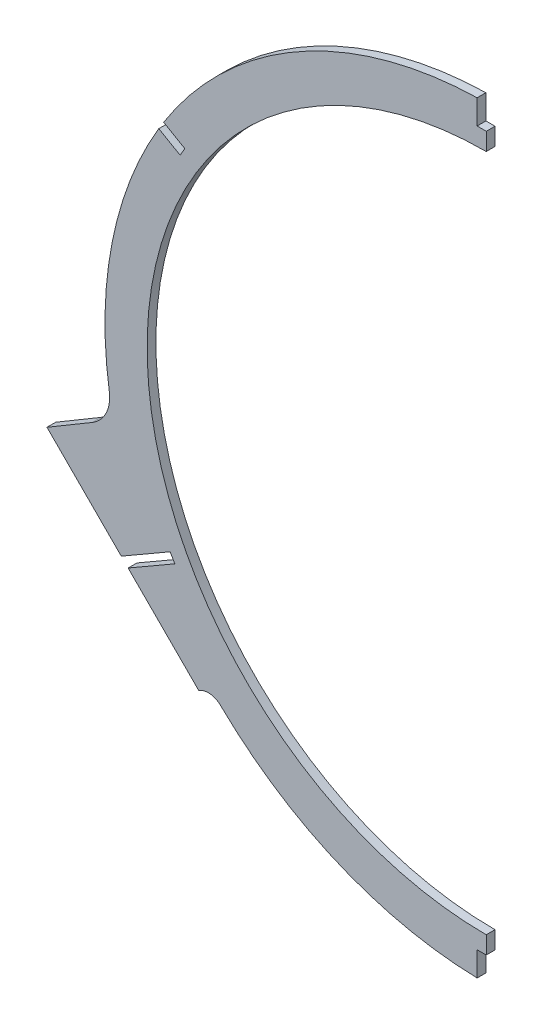
from build123d import *

# Parameters (mm, degrees)
SKETCH2_R           = 137.922
SKETCH2_R_2         = 122.682
BOSS_EXTRUDE2_DEPTH = 1.5875
SKETCH3_W           = 290.977734258
SKETCH3_H           = 504.828840158
CUT_EXTRUDE1_DEPTH  = 205.235122161
BOSS_EXTRUDE3_DEPTH = 1.5875
FILLET2_R           = 6.35
FILLET3_R           = 12.7
SKETCH5_W           = 3.302
SKETCH5_H           = 10.16
SKETCH5_H_2         = 10.320651629
CUT_EXTRUDE2_DEPTH  = 219.975089365


with BuildPart() as part:
    # Sketch2 → Boss-Extrude2 (new, symmetric)
    with BuildSketch(Plane(origin=(248.273568551, -245.01347209, 0), x_dir=(0, -1, 0), z_dir=(0, 0, -1))):
        with Locations(Location((-257.71347209, 248.273568551, 0), (0, 0, 180))):
            Circle(SKETCH2_R)
        with Locations(Location((-257.71347209, 248.273568551, 0), (0, 0, 180))):
            Circle(SKETCH2_R_2, mode=Mode.SUBTRACT)
    extrude(amount=BOSS_EXTRUDE2_DEPTH, both=True)

    # Sketch3 → Cut-Extrude1 (cut, through all)
    with BuildSketch(Plane(origin=(0, 0, 0), x_dir=(0, 0, -1), z_dir=(1, 0, 0))):
        with Locations((4.206907001, 10.947122083)):
            Rectangle(SKETCH3_W, SKETCH3_H)
    extrude(amount=CUT_EXTRUDE1_DEPTH, mode=Mode.SUBTRACT)

    # Sketch4 → Boss-Extrude3 (add, symmetric)
    with BuildSketch(Plane.XY):
        with BuildLine():
            Line((-158.91199531, -30.452559211), (-104.007060596, -85.469026207))
            ThreePointArc((-104.007060596, -85.469026207), (-101.940396796, -83.943553525), (-99.869204781, -82.424234664))
            ThreePointArc((-99.869204781, -82.424234664), (-121.945025923, -51.735150773), (-134.859098706, -16.205044198))
            Line((-134.859098706, -16.205044198), (-158.91199531, -30.452559211))
        make_face()
    extrude(amount=BOSS_EXTRUDE3_DEPTH, both=True)

    # Fillet2
    # the kernel refuses this fillet: 6.35 mm, written as the material it adds along each edge
    with BuildSketch(Plane(origin=(-99.869204781, -82.424234664, 1.5875), x_dir=(0.7036137196097393, -0.7105826718805821, 0), z_dir=(0, 0, -1))) as fillet2_piece_1:
        with BuildLine():
            CenterArc((5.474610705, 6.348804924), FILLET2_R, 191.50159108, 77.386791497)
            Line((-0.747876011, 5.082645744), (-0.872325745, 5.057322561))
            ThreePointArc((-0.872325745, 5.057322561), (-0.503364548, 2.522278655), (-0.12559154, -0.018861738))
            Line((-0.12559154, -0.018861738), (0.002463821, -0.126976098))
            ThreePointArc((0.002463821, -0.126976098), (2.675709823, -0.101042949), (5.348955824, -0.126976098))
            Line((5.348955824, -0.126976098), (5.351419645, 0))
        make_face()
    extrude(amount=3.175)

    # Fillet3
    fillet3_edges = [part.edges().sort_by_distance(p)[0] for p in [
        (-134.859098706, -16.205044198, 0),
    ]]
    fillet(fillet3_edges, radius=FILLET3_R)

    # Sketch5 → Cut-Extrude2 (cut, through all)
    with BuildSketch(Plane(origin=(0, 0, -1.5875), x_dir=(-1, 0, 0), z_dir=(0, 0, -1))):
        with Locations((1.651, 146.812)):
            Rectangle(SKETCH5_W, SKETCH5_H)
        Polygon((109.043255392, 81.788598611), (110.732355392, 78.862991592), (120.034009933, 84.233304346), (118.344909933, 87.158911365), align=None)
        with Locations((1.651, -121.492325815)):
            Rectangle(SKETCH5_W, SKETCH5_H_2)
        Polygon((112.665009205, -50.115536994), (114.354109205, -47.189929975), (136.351154461, -59.889929975), (134.662054461, -62.815536994), align=None)
    extrude(amount=-CUT_EXTRUDE2_DEPTH, mode=Mode.SUBTRACT)


solid = part.part
